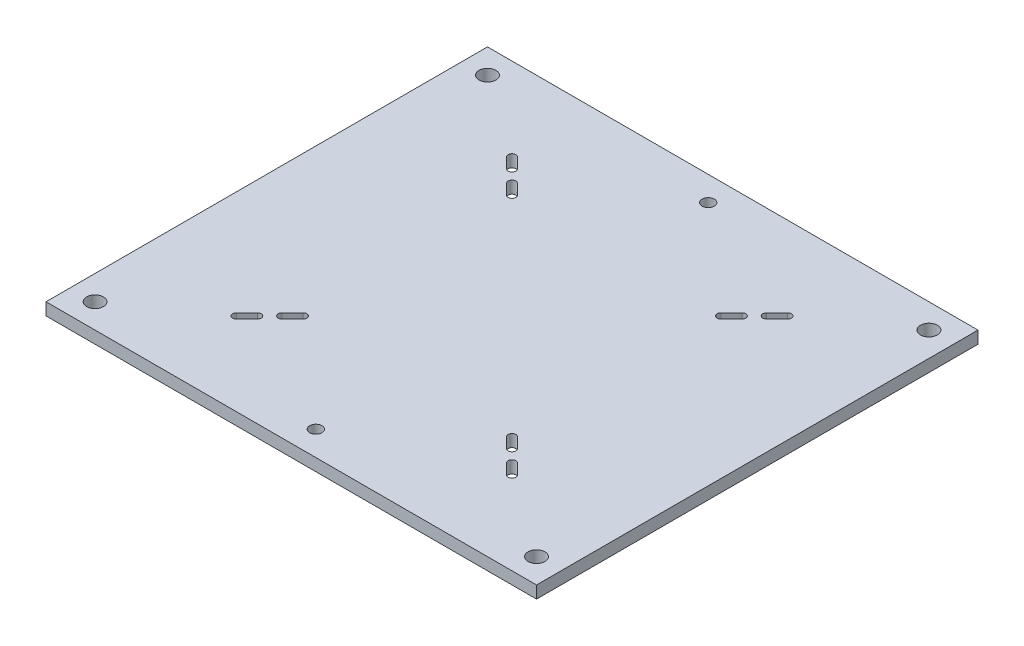
from build123d import *

# Parameters (mm, degrees)
SKETCH1_W                            = 254
SKETCH1_H                            = 228.6
BASE_PLATE_DEPTH                     = 6.35
SLOTS_DEPTH                          = 342.781044676
FEET_CONNECTION_HOLE_D               = 8.7376
HOLE_FOR_10_BLIND_FASTENERS_B_BS_1_D = 6.35


with BuildPart() as part:
    # Sketch1 → base plate (new body)
    with BuildSketch(Plane(origin=(0, 0, 0), x_dir=(1, 0, 0), z_dir=(0, 1, 0))):
        with Locations((127, -114.3)):
            Rectangle(SKETCH1_W, SKETCH1_H)
    extrude(amount=-BASE_PLATE_DEPTH)

    # Sketch3 → slots (cut, through all)
    with BuildSketch(Plane(origin=(0, 0, 0), x_dir=(1, 0, 0), z_dir=(0, 1, 0))):
        with BuildLine():
            Line((59.64618524, -178.825387544), (54.258031568, -184.213541217))
            ThreePointArc((54.258031568, -184.213541217), (54.258031568, -187.041968432), (57.086458783, -187.041968432))
            Line((57.086458783, -187.041968432), (62.474612456, -181.65381476))
            ThreePointArc((62.474612456, -181.65381476), (62.474612456, -178.825387544), (59.64618524, -178.825387544))
        make_face()
        with BuildLine():
            Line((68.895142119, -175.233285096), (74.283295792, -169.845131423))
            ThreePointArc((74.283295792, -169.845131423), (74.283295792, -167.016704208), (71.454868577, -167.016704208))
            Line((71.454868577, -167.016704208), (66.066714904, -172.404857881))
            ThreePointArc((66.066714904, -172.404857881), (66.066714904, -175.233285096), (68.895142119, -175.233285096))
        make_face()
        with BuildLine():
            ThreePointArc((57.086458783, -41.558031568), (54.258031568, -41.558031568), (54.258031568, -44.386458783))
            Line((54.258031568, -44.386458783), (59.64618524, -49.774612456))
            ThreePointArc((59.64618524, -49.774612456), (62.474612456, -49.774612456), (62.474612456, -46.94618524))
            Line((62.474612456, -46.94618524), (57.086458783, -41.558031568))
        make_face()
        with BuildLine():
            ThreePointArc((71.454868577, -61.583295792), (74.283295792, -61.583295792), (74.283295792, -58.754868577))
            Line((74.283295792, -58.754868577), (68.895142119, -53.366714904))
            ThreePointArc((68.895142119, -53.366714904), (66.066714904, -53.366714904), (66.066714904, -56.195142119))
            Line((66.066714904, -56.195142119), (71.454868577, -61.583295792))
        make_face()
        with BuildLine():
            Line((194.35381476, -49.774612456), (199.741968432, -44.386458783))
            ThreePointArc((199.741968432, -44.386458783), (199.741968432, -41.558031568), (196.913541217, -41.558031568))
            Line((196.913541217, -41.558031568), (191.525387544, -46.94618524))
            ThreePointArc((191.525387544, -46.94618524), (191.525387544, -49.774612456), (194.35381476, -49.774612456))
        make_face()
        with BuildLine():
            Line((185.104857881, -53.366714904), (179.716704208, -58.754868577))
            ThreePointArc((179.716704208, -58.754868577), (179.716704208, -61.583295792), (182.545131423, -61.583295792))
            Line((182.545131423, -61.583295792), (187.933285096, -56.195142119))
            ThreePointArc((187.933285096, -56.195142119), (187.933285096, -53.366714904), (185.104857881, -53.366714904))
        make_face()
        with BuildLine():
            ThreePointArc((182.545131423, -167.016704208), (179.716704208, -167.016704208), (179.716704208, -169.845131423))
            Line((179.716704208, -169.845131423), (185.104857881, -175.233285096))
            ThreePointArc((185.104857881, -175.233285096), (187.933285096, -175.233285096), (187.933285096, -172.404857881))
            Line((187.933285096, -172.404857881), (182.545131423, -167.016704208))
        make_face()
        with BuildLine():
            ThreePointArc((196.913541217, -187.041968432), (199.741968432, -187.041968432), (199.741968432, -184.213541217))
            Line((199.741968432, -184.213541217), (194.35381476, -178.825387544))
            ThreePointArc((194.35381476, -178.825387544), (191.525387544, -178.825387544), (191.525387544, -181.65381476))
            Line((191.525387544, -181.65381476), (196.913541217, -187.041968432))
        make_face()
    extrude(amount=-SLOTS_DEPTH, mode=Mode.SUBTRACT)

    # Feet connection hole (through all)
    with Locations(Plane(origin=(0, 0, 0), x_dir=(1, 0, 0), z_dir=(0, 1, 0))):
        with Locations((12.7, -215.9), (241.3, -12.7), (12.7, -12.7), (241.3, -215.9)):
            Hole(FEET_CONNECTION_HOLE_D / 2)

    # Hole for #10 Blind Fasteners (B,BS)1 (through all)
    with Locations(Plane(origin=(0, 0, 0), x_dir=(1, 0, 0), z_dir=(0, 1, 0))):
        with Locations((127, -215.9), (127, -12.7)):
            Hole(HOLE_FOR_10_BLIND_FASTENERS_B_BS_1_D / 2)


solid = part.part
